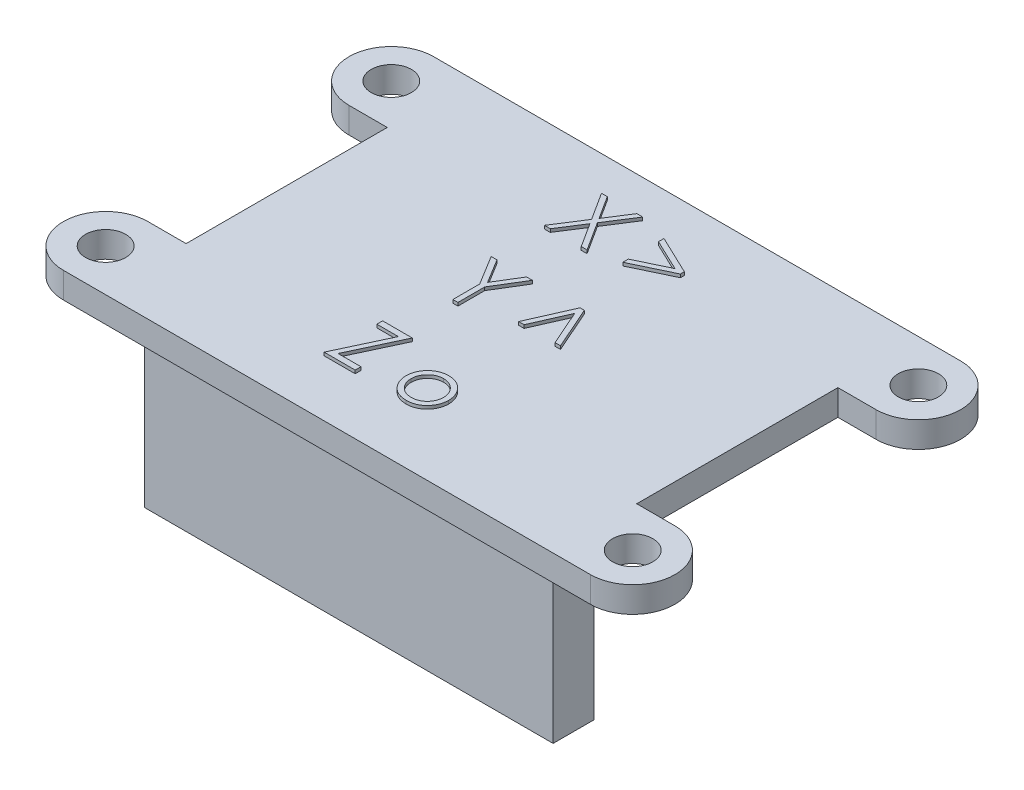
from build123d import *

# Parameters (mm, degrees)
BOSS_EXTRUDE1_DEPTH = 1.6
SKETCH2_R           = 1.25
CUT_EXTRUDE1_DEPTH  = 23.266791271
SKETCH3_W           = 25.4
SKETCH3_H           = 2.54
BOSS_EXTRUDE2_DEPTH = 10
BOSS_EXTRUDE3_DEPTH = 0.2


with BuildPart() as part:
    # Sketch1 → Boss-Extrude1 (new body)
    with BuildSketch(Plane(origin=(0, 0, 0), x_dir=(1, 0, 0), z_dir=(0, 1, 0))):
        with BuildLine():
            Line((-14, 11.5), (-16.374999829, 11.5))
            ThreePointArc((-16.374999829, 11.5), (-18.999999829, 8.875), (-16.374999829, 6.25))
            Line((-16.374999829, 6.25), (-14, 6.25))
            Line((-14, 6.25), (-14, -6.25))
            Line((-14, -6.25), (-16.374999829, -6.25))
            ThreePointArc((-16.374999829, -6.25), (-18.999999829, -8.875), (-16.374999829, -11.5))
            Line((-16.374999829, -11.5), (-14, -11.5))
            Line((-14, -11.5), (14, -11.5))
            Line((14, -11.5), (16.374999829, -11.5))
            ThreePointArc((16.374999829, -11.5), (18.999999829, -8.875), (16.374999829, -6.25))
            Line((16.374999829, -6.25), (14, -6.25))
            Line((14, -6.25), (14, 6.25))
            Line((14, 6.25), (16.374999829, 6.25))
            ThreePointArc((16.374999829, 6.25), (18.999999829, 8.875), (16.374999829, 11.5))
            Line((16.374999829, 11.5), (14, 11.5))
            Line((14, 11.5), (-14, 11.5))
        make_face()
    extrude(amount=BOSS_EXTRUDE1_DEPTH)

    # Sketch2 → Cut-Extrude1 (cut, through all)
    with BuildSketch(Plane(origin=(0, 1.6, 0), x_dir=(1, 0, 0), z_dir=(0, 1, 0))):
        with Locations((-16.374999829, 8.875)):
            Circle(SKETCH2_R)
        with Locations((16.374999829, 8.875)):
            Circle(SKETCH2_R)
        with Locations((16.374999829, -8.875)):
            Circle(SKETCH2_R)
        with Locations((-16.374999829, -8.875)):
            Circle(SKETCH2_R)
    extrude(amount=-CUT_EXTRUDE1_DEPTH, mode=Mode.SUBTRACT)

    # Sketch3 → Boss-Extrude2 (add)
    with BuildSketch(Plane.XZ):
        with Locations((0, 8.875)):
            Rectangle(SKETCH3_W, SKETCH3_H)
    extrude(amount=BOSS_EXTRUDE2_DEPTH)

    # Sketch4 → Boss-Extrude3 (add)
    # profile 1 of 6: a face of its own
    with BuildSketch(Plane(origin=(0, 1.6, 0), x_dir=(1, 0, 0), z_dir=(0, 1, 0))):
        Polygon((-3.603530873, 9.165262271), (-3.241050905, 9.165262271), (-2.324684719, 7.733571566), (-1.408318533, 9.165262271), (-1.045838565, 9.165262271), (-2.143094174, 7.450318361), (-1.00096677, 5.665262271), (-1.363446738, 5.665262271), (-2.324684719, 7.167065156), (-3.2859227, 5.665262271), (-3.648402668, 5.665262271), (-2.505574142, 7.450318361), align=None)
    # profile 2 of 6: a face of its own
    with BuildSketch(Plane(origin=(0, 1.6, 0), x_dir=(1, 0, 0), z_dir=(0, 1, 0))):
        Polygon((0.771469127, 6.455426534), (2.736012396, 7.392826374), (0.771469127, 8.330226214), (0.771469127, 8.671672528), (3.19454605, 7.515522688), (3.19454605, 7.27013006), (0.771469127, 6.11398022), align=None)
    # profile 3 of 6: a face of its own
    with BuildSketch(Plane(origin=(0, 1.6, 0), x_dir=(1, 0, 0), z_dir=(0, 1, 0))):
        Polygon((-3.62596677, 2.331928938), (-3.26629129, 2.331928938), (-2.346419495, 0.828022688), (-1.427949944, 2.331928938), (-1.068274463, 2.331928938), (-2.190069335, 0.495690957), (-2.190069335, -1.168071062), (-2.504171899, -1.168071062), (-2.504171899, 0.495690957), align=None)
    # profile 4 of 6: a face of its own
    with BuildSketch(Plane(origin=(0, 1.6, 0), x_dir=(1, 0, 0), z_dir=(0, 1, 0))):
        Polygon((1.893263999, 2.331928938), (2.162494768, 2.331928938), (3.329161435, -0.315506959), (2.990519608, -0.315506959), (2.027879383, 1.868487432), (1.065239159, -0.315506959), (0.726597332, -0.315506959), align=None)
    # profile 5 of 6: a face of its own
    with BuildSketch(Plane(origin=(0, 1.6, 0), x_dir=(1, 0, 0), z_dir=(0, 1, 0))):
        Polygon((-3.536223181, -4.860378754), (-3.536223181, -4.501404395), (-1.696479591, -4.501404395), (-3.164628629, -7.642430036), (-1.741351386, -7.642430036), (-1.741351386, -8.001404395), (-3.670838565, -8.001404395), (-2.202689527, -4.860378754), align=None)
    # profile 6 of 6: a face of its own
    with BuildSketch(Plane(origin=(0, 1.6, 0), x_dir=(1, 0, 0), z_dir=(0, 1, 0))):
        with BuildLine():
            add(Edge.make_bspline(
                [(1.468384191, -5.398840293), (1.516375464, -5.399862184), (1.610474622, -5.401865863), (1.748282507, -5.423280828), (1.879827643, -5.456028193), (2.005613835, -5.501299755), (2.124030131, -5.561981705), (2.236801375, -5.634390996), (2.343618384, -5.72017359), (2.407641413, -5.786531658), (2.440138999, -5.820214492)],
                knots=[0, 0, 0, 0, 1.054011418, 2.066658804, 3.057071809, 4.030435133, 4.997543892, 5.974964718, 6.972108034, 8, 8, 8, 8], degree=3))
            add(Edge.make_bspline(
                [(2.440138999, -5.820214492), (2.468120953, -5.852428477), (2.523543333, -5.91623302), (2.594609052, -6.019688632), (2.655830612, -6.126828733), (2.704893573, -6.23907606), (2.743578597, -6.355450731), (2.771044293, -6.476352742), (2.787381228, -6.601515089), (2.789584195, -6.686518927), (2.790699896, -6.729569459)],
                knots=[0, 0, 0, 0, 1.025258237, 2.030674902, 3.01204498, 3.988269485, 4.97094183, 5.956517959, 6.965070386, 8, 8, 8, 8], degree=3))
            add(Edge.make_bspline(
                [(2.790699896, -6.729569459), (2.789718559, -6.772869517), (2.787779391, -6.85843245), (2.769435774, -6.984451816), (2.740904688, -7.106646639), (2.70007285, -7.224505333), (2.647714741, -7.33838816), (2.583824053, -7.447797709), (2.507952436, -7.552949843), (2.421948439, -7.652951681), (2.326896563, -7.745117896), (2.223780415, -7.825446165), (2.114626381, -7.89426769), (1.997983028, -7.949704105), (1.874915541, -7.993413806), (1.745158473, -8.024113822), (1.608913403, -8.042675506), (1.515886181, -8.045059079), (1.468384191, -8.04627619)],
                knots=[0, 0, 0, 0, 0.998656419, 1.973391657, 2.932242238, 3.890759089, 4.846373663, 5.82037756, 6.809684879, 7.83454468, 8.860553229, 9.859544525, 10.845671541, 11.83227036, 12.833544569, 13.85385346, 14.904124723, 16, 16, 16, 16], degree=3))
            add(Edge.make_bspline(
                [(1.468384191, -8.04627619), (1.420649472, -8.045054994), (1.327158612, -8.04266322), (1.19043263, -8.024185937), (1.060443011, -7.993427954), (0.937214412, -7.949560461), (0.820069566, -7.894265918), (0.710283069, -7.825654228), (0.607083153, -7.745094073), (0.512011169, -7.652958136), (0.426012563, -7.55294818), (0.350139555, -7.447798141), (0.286249229, -7.338388048), (0.233891025, -7.224505363), (0.193059212, -7.106646631), (0.164528119, -6.984451818), (0.146184505, -6.85843245), (0.144245336, -6.772869517), (0.143263999, -6.729569459)],
                knots=[0, 0, 0, 0, 1.099876186, 2.154163076, 3.173186993, 4.173200201, 5.163417411, 6.152872554, 7.150605724, 8.17532212, 9.198891216, 10.186952605, 11.159729845, 12.11414092, 13.071450619, 14.029093627, 15.002601286, 16, 16, 16, 16], degree=3))
            add(Edge.make_bspline(
                [(0.143263999, -6.729569459), (0.144387309, -6.686752914), (0.146611271, -6.601983511), (0.16293178, -6.477056451), (0.190290336, -6.356359061), (0.229021733, -6.240433585), (0.278536924, -6.128678149), (0.338898211, -6.021273318), (0.410688844, -5.918285518), (0.465890796, -5.854563438), (0.493824896, -5.822317857)],
                knots=[0, 0, 0, 0, 1.031353054, 2.041901799, 3.029428768, 4.008703097, 4.981709435, 5.96992636, 6.972712378, 8, 8, 8, 8], degree=3))
            add(Edge.make_bspline(
                [(0.493824896, -5.822317857), (0.526273487, -5.788342918), (0.590089351, -5.721525221), (0.697438079, -5.635992697), (0.8099319, -5.562076623), (0.929656826, -5.502600408), (1.055339684, -5.45576189), (1.187558927, -5.423196375), (1.325834442, -5.40194302), (1.420394063, -5.399884842), (1.468384191, -5.398840293)],
                knots=[0, 0, 0, 0, 1.027980169, 2.021703884, 2.998553061, 3.971491411, 4.943284454, 5.930300938, 6.949603206, 8, 8, 8, 8], degree=3))
        make_face()
        with BuildLine():
            add(Edge.make_bspline(
                [(1.466981948, -5.712942857), (1.433044336, -5.713907449), (1.366045208, -5.715811731), (1.267425623, -5.730295636), (1.172485469, -5.75324314), (1.081044625, -5.785847196), (0.993411452, -5.827946095), (0.90950205, -5.879654455), (0.82906961, -5.940287412), (0.753687547, -6.009750083), (0.684505235, -6.085629078), (0.624027258, -6.166477437), (0.572602152, -6.250983783), (0.529761993, -6.339235994), (0.497854805, -6.432128408), (0.474681782, -6.528609039), (0.460211542, -6.628874456), (0.458325163, -6.697035474), (0.457366563, -6.731672825)],
                knots=[0, 0, 0, 0, 1.021534396, 2.016698045, 2.994645724, 3.958388632, 4.93408049, 5.916473867, 6.921342795, 7.962252576, 8.998418191, 10.008913653, 10.997312074, 11.973003931, 12.956656626, 13.948281152, 14.957379055, 16, 16, 16, 16], degree=3))
            add(Edge.make_bspline(
                [(0.457366563, -6.731672825), (0.458973387, -6.776424852), (0.462162631, -6.865249258), (0.488097867, -6.99606038), (0.531484147, -7.121642232), (0.590071427, -7.241258618), (0.663477646, -7.351930896), (0.749964712, -7.450602381), (0.848604413, -7.535788192), (0.958220913, -7.606469038), (1.076575231, -7.662628793), (1.201831552, -7.702427769), (1.332472246, -7.728299462), (1.421752977, -7.730870936), (1.466981948, -7.732173626)],
                knots=[0, 0, 0, 0, 1.016792936, 2.018143844, 3.017858371, 4.030088057, 5.03801393, 6.028138512, 7.003788237, 7.991172063, 8.984598303, 9.972568034, 10.972917682, 12, 12, 12, 12], degree=3))
            add(Edge.make_bspline(
                [(1.466981948, -7.732173626), (1.512208316, -7.730863346), (1.601483912, -7.728276889), (1.731943089, -7.702558069), (1.856857061, -7.662454409), (1.975088449, -7.606532199), (2.084655052, -7.535519784), (2.184004173, -7.451083407), (2.269752785, -7.351669556), (2.343086389, -7.241112027), (2.402633132, -7.121827675), (2.445816334, -6.996037202), (2.47181392, -6.86525516), (2.474994749, -6.77642683), (2.476597332, -6.731672825)],
                knots=[0, 0, 0, 0, 1.02726834, 2.027799167, 3.010890988, 4.004497153, 4.992059811, 5.971914811, 6.958719428, 7.966827853, 8.981595046, 9.981490638, 10.983022906, 12, 12, 12, 12], degree=3))
            add(Edge.make_bspline(
                [(2.476597332, -6.731672825), (2.475639062, -6.697035267), (2.473753333, -6.628873841), (2.459278369, -6.528611388), (2.436122829, -6.432119791), (2.404151212, -6.339267788), (2.361497198, -6.250755284), (2.309080405, -6.166725557), (2.248849379, -6.085349011), (2.178832258, -6.00999537), (2.103528881, -5.940260333), (2.023063842, -5.879630944), (1.939278864, -5.828173348), (1.851900281, -5.785487108), (1.760447714, -5.753539767), (1.665640584, -5.730163136), (1.567441774, -5.715872939), (1.500682731, -5.713925798), (1.466981948, -5.712942857)],
                knots=[0, 0, 0, 0, 1.042956736, 2.052379634, 3.044323526, 4.02829302, 5.004299113, 5.996692471, 7.007513377, 8.048758398, 9.090003419, 10.095195979, 11.07790575, 12.047570684, 13.018257071, 13.989683339, 14.985167495, 16, 16, 16, 16], degree=3))
        make_face(mode=Mode.SUBTRACT)
    extrude(amount=BOSS_EXTRUDE3_DEPTH)


solid = part.part
